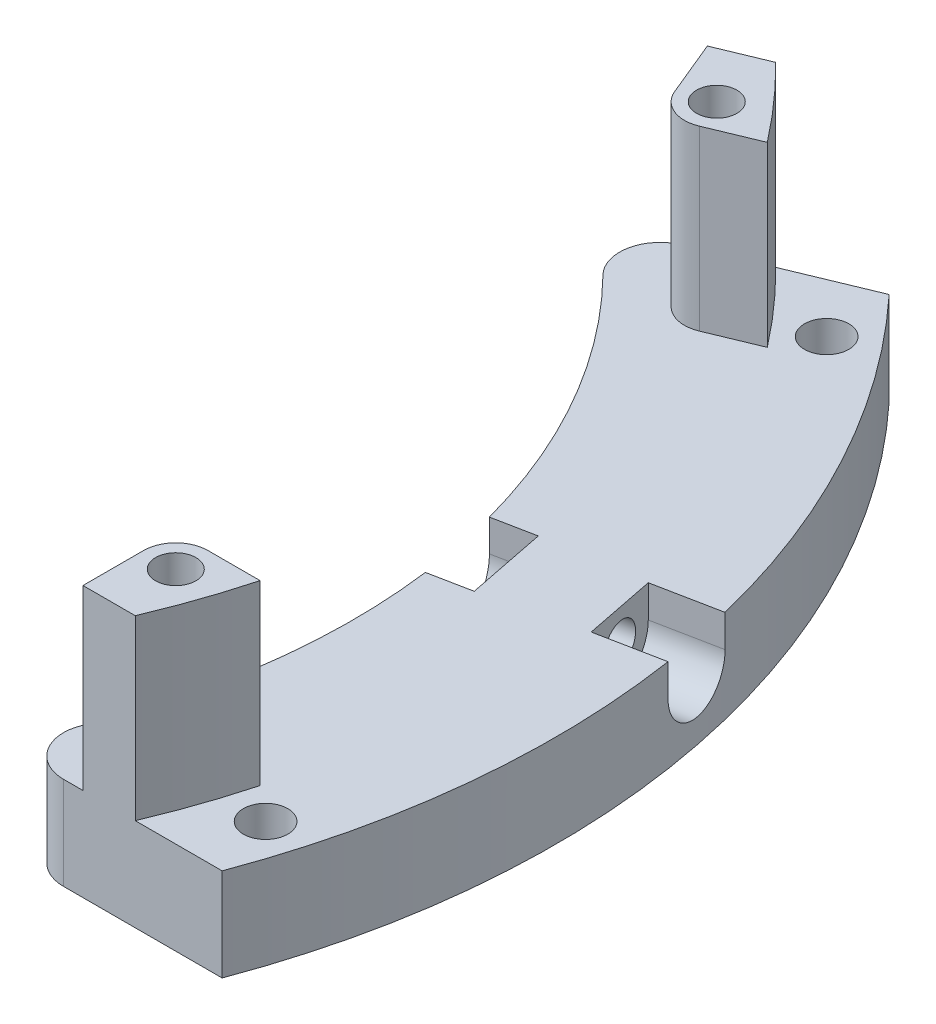
from build123d import *

# Parameters (mm, degrees)
BOSS_EXTRUDE1_DEPTH = 11.5
BOSS_EXTRUDE2_DEPTH = 22
SKETCH3_R           = 2.5
CUT_EXTRUDE1_DEPTH  = 4
SKETCH4_R           = 4.5
CUT_EXTRUDE2_DEPTH  = 5
SKETCH5_R           = 2.75
CUT_EXTRUDE3_DEPTH  = 125.343311555
SKETCH6_R           = 2.5
CUT_EXTRUDE4_DEPTH  = 79.78509189
CUT_EXTRUDE5_DEPTH  = 8.2
CUT_EXTRUDE6_DEPTH  = 9
FILLET1_R           = 5.05
FILLET2_R           = 5


with BuildPart() as part:
    # Sketch1 → Boss-Extrude1 (new body)
    with BuildSketch(Plane(origin=(0, 0, 0), x_dir=(1, 0, 0), z_dir=(0, 1, 0))):
        with BuildLine():
            Line((66.174969976, -35), (93.674969976, -35))
            ThreePointArc((93.674969976, -35), (98.07852804, 19.509032202), (73.150467337, 68.183642675))
            Line((73.150467337, 68.183642675), (47.743780193, 57.659848285))
            ThreePointArc((47.743780193, 57.659848285), (73.422287359, 14.604600997), (66.174969976, -35))
        make_face()
    extrude(amount=BOSS_EXTRUDE1_DEPTH)

    # Sketch2 → Boss-Extrude2 (add)
    with BuildSketch(Plane.XZ.offset(-11.5)):
        with BuildLine():
            Line((80.428539711, 23.5), (86.877787725, 23.5))
            ThreePointArc((86.877787725, 23.5), (85.091202872, 29.317012019), (82.915619759, 35))
            Line((82.915619759, 35), (76.428539711, 35))
            Line((76.428539711, 35), (76.428539711, 27.5))
            ThreePointArc((76.428539711, 27.5), (77.600112586, 24.671572875), (80.428539711, 23.5))
        make_face()
        with BuildLine():
            Line((60.086969148, -54.654623051), (57.216843406, -61.583719545))
            Line((57.216843406, -61.583719545), (63.210123888, -64.066217604))
            ThreePointArc((63.210123888, -64.066217604), (67.394885944, -59.648380938), (71.271549248, -54.957859017))
            Line((71.271549248, -54.957859017), (65.313221008, -52.489838651))
            ThreePointArc((65.313221008, -52.489838651), (62.251753549, -52.489838651), (60.086969148, -54.654623051))
        make_face()
    extrude(amount=-BOSS_EXTRUDE2_DEPTH)

    # Sketch3 → Cut-Extrude1 (cut)
    with BuildSketch(Plane(origin=(0, 33.5, 0), x_dir=(1, 0, 0), z_dir=(0, 1, 0))):
        with Locations(Location((63.782487278, 56.185356781, 0), (0, 0, 270))):
            Circle(SKETCH3_R)
        with Locations(Location((80.428539711, -27.5, 0), (0, 0, 270))):
            Circle(SKETCH3_R)
    extrude(amount=-CUT_EXTRUDE1_DEPTH, mode=Mode.SUBTRACT)

    # Sketch4 → Cut-Extrude2 (cut)
    with BuildSketch(Plane.XZ):
        with Locations(Location((91.060743988, 27, 0), (0, 0, 270))):
            Circle(SKETCH4_R)
        with Locations(Location((73.796704912, -59.792185441, 0), (0, 0, 270))):
            Circle(SKETCH4_R)
    extrude(amount=-CUT_EXTRUDE2_DEPTH, mode=Mode.SUBTRACT)

    # Sketch5 → Cut-Extrude3 (cut, through all)
    with BuildSketch(Plane.XZ.offset(-5)):
        with Locations(Location((91.060743988, 27, 0), (0, 0, 270))):
            Circle(SKETCH5_R)
        with Locations(Location((73.796704912, -59.792185441, 0), (0, 0, 270))):
            Circle(SKETCH5_R)
    extrude(amount=-CUT_EXTRUDE3_DEPTH, mode=Mode.SUBTRACT)

    # Sketch6 → Cut-Extrude4 (cut, through all)
    with BuildSketch(Plane(origin=(56.959375084, 0, -11.329924142), x_dir=(0.19509032201612866, 0, 0.9807852804032304), z_dir=(-0.9807852804032304, 0, 0.19509032201612866))):
        with Locations((0, 7.5)):
            Circle(SKETCH6_R)
    extrude(amount=-CUT_EXTRUDE4_DEPTH, mode=Mode.SUBTRACT)

    # Sketch8 → Cut-Extrude5 (cut)
    with BuildSketch(Plane(origin=(98.07852804, 0, -19.509032202), x_dir=(-0.19509032201612866, 0, -0.9807852804032304), z_dir=(0.9807852804032304, 0, -0.19509032201612866))):
        with BuildLine():
            Line((-4.5, 7.5), (-4.5, 11.5))
            Line((-4.5, 11.5), (4.5, 11.5))
            Line((4.5, 11.5), (4.5, 7.5))
            ThreePointArc((4.5, 7.5), (0, 3), (-4.5, 7.5))
        make_face()
    extrude(amount=-CUT_EXTRUDE5_DEPTH, mode=Mode.SUBTRACT)

    # Sketch7 → Cut-Extrude6 (cut)
    with BuildSketch(Plane(origin=(0, 11.5, 0), x_dir=(1, 0, 0), z_dir=(0, 1, 0))):
        Polygon((69.47485004, 18.968342244), (71.445262293, 9.062410912), (79.291544536, 10.623133488), (77.321132284, 20.52906482), align=None)
    extrude(amount=-CUT_EXTRUDE6_DEPTH, mode=Mode.SUBTRACT)

    # Fillet1
    # the kernel refuses this fillet: 5.05 mm, written as the material it adds along each edge
    with BuildSketch(Plane(origin=(61.857828731, 2.5, -7.155351805), x_dir=(0, 1, 0), z_dir=(0.9807852804032302, 0, -0.1950903220161298))) as fillet1_piece_1_section:
        with BuildLine():
            CenterArc((FILLET1_R, -FILLET1_R), FILLET1_R, 90, 90)
            Line((0, -FILLET1_R), (0, 0))
            Line((0, 0), (FILLET1_R, 0))
        make_face()
    fillet1_piece_1 = extrude(amount=30.40026249, mode=Mode.PRIVATE)
    fillet1_piece_1 = fillet1_piece_1 - Plane(origin=(0, 3.649852304, 0), x_dir=(0.6377681563457176, 0, -0.7702283938880625), z_dir=(0, -1, 0)) * Cylinder(74.860715007, 82, mode=Mode.PRIVATE)
    add(fillet1_piece_1)
    with BuildSketch(Plane(origin=(89.703546449, 2.5, -22.992080135), x_dir=(0, 1, 0), z_dir=(-0.9807852804032304, 0, 0.19509032201612841))) as fillet1_piece_2_section:
        with BuildLine():
            CenterArc((FILLET1_R, -FILLET1_R), FILLET1_R, 90, 90)
            Line((0, -FILLET1_R), (0, 0))
            Line((0, 0), (FILLET1_R, 0))
        make_face()
    fillet1_piece_2 = extrude(amount=30.40026249, mode=Mode.PRIVATE)
    fillet1_piece_2 = fillet1_piece_2 - Plane(origin=(0, 3.643295327, 0), x_dir=(0.6377681563457176, 0, -0.7702283938880625), z_dir=(0, -1, 0)) * Cylinder(74.860715007, 82, mode=Mode.PRIVATE)
    add(fillet1_piece_2)

    # Fillet2
    fillet2_edges = [part.edges().sort_by_distance(p)[0] for p in [
        (66.174969976, 5.75, 35),
        (47.743780193, 5.75, -57.659848285),
    ]]
    fillet(fillet2_edges, radius=FILLET2_R)


solid = part.part
